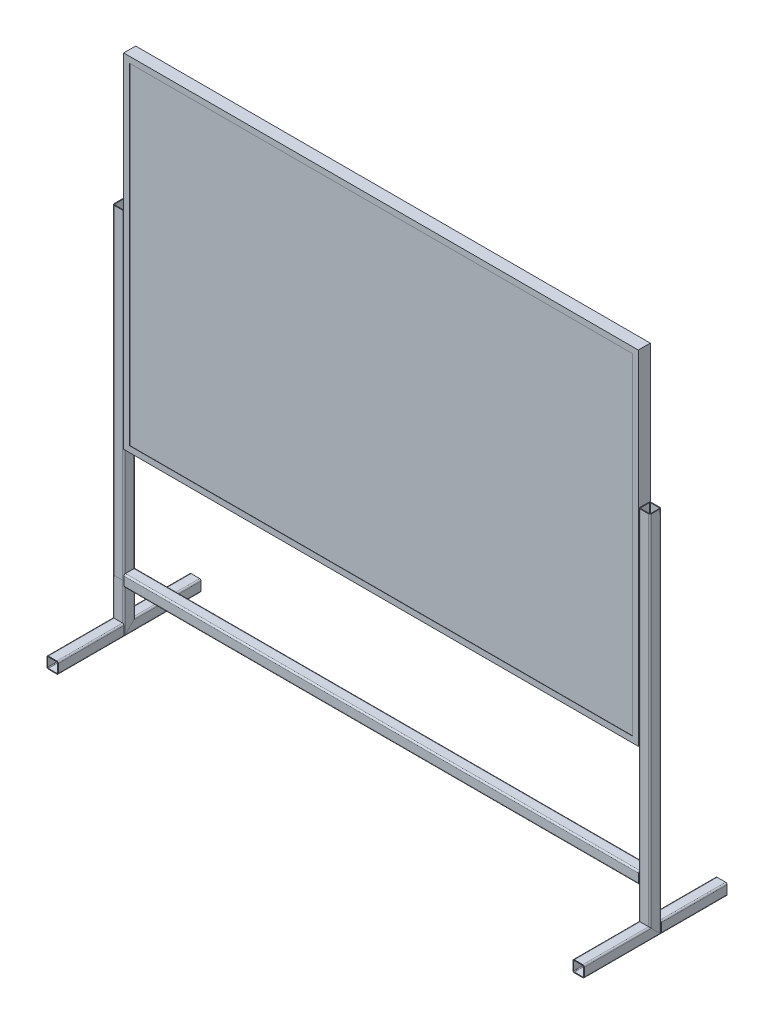
from build123d import *

# Parameters (mm, degrees)
SKETCH1_W                               = 1800
SKETCH1_H                               = 1200
SKETCH1_W_2                             = 1760
SKETCH1_H_2                             = 1160
BOSS_EXTRUDE1_DEPTH                     = 40
SKETCH1_3_W                             = 1800
SKETCH1_3_H                             = 1200
SKETCH1_3_W_2                           = 1760
SKETCH1_3_H_2                           = 1160
BOSS_EXTRUDE2_DEPTH                     = 1
BOSS_EXTRUDE3_START                     = 40
SKETCH1_5_W                             = 1800
SKETCH1_5_H                             = 1200
SKETCH1_5_W_2                           = 1760
SKETCH1_5_H_2                           = 1160
BOSS_EXTRUDE3_DEPTH                     = 1
SKETCH2_W                               = 42
SKETCH2_H                               = 1200
BOSS_EXTRUDE4_DEPTH                     = 1
BOSS_EXTRUDE5_START                     = -1800
SKETCH2_2_W                             = 42
SKETCH2_2_H                             = 1200
BOSS_EXTRUDE5_DEPTH                     = 1
SKETCH3_W                               = 1802
SKETCH3_H                               = 42
BOSS_EXTRUDE6_DEPTH                     = 1
BOSS_EXTRUDE7_START                     = -1200
SKETCH3_2_W                             = 1802
SKETCH3_2_H                             = 42
BOSS_EXTRUDE7_DEPTH                     = 1
TUBE_START                              = -230
TUBE_SQUARE_40_X_40_X_2_6_1_DEPTH       = 230
TUBE_START_2                            = 40
TUBE_SQUARE_40_X_40_X_2_6_1_2_DEPTH     = 230
TUBE_START_3                            = 901.060567096
TUBE_SQUARE_40_X_40_X_2_6_1_3_DEPTH     = 39.871863602
TUBE_START_4                            = 901
TUBE_SQUARE_40_X_40_X_2_6_1_4_DEPTH     = 40
TUBE_START_5                            = -1
TUBE_SQUARE_40_X_40_X_2_6_1_5_DEPTH     = 41
TUBE_START_6                            = -1171
TUBE_SQUARE_40_X_40_X_2_6_1_6_DEPTH     = 1292
TUBE_START_7                            = -857
TUBE_SQUARE_40_X_40_X_2_6_1_7_OUTLINE_W = 42
TUBE_SQUARE_40_X_40_X_2_6_1_7_OUTLINE_H = 60
TUBE_SQUARE_40_X_40_X_2_6_1_7_DEPTH     = 28.977959231
TUBE_SQUARE_40_X_40_X_2_6_1_8_DEPTH     = 230
TUBE_SQUARE_40_X_40_X_2_6_1_9_DEPTH     = 230
TUBE_START_8                            = -940.939432904
TUBE_SQUARE_40_X_40_X_2_6_1_10_DEPTH    = 39.871863602
TUBE_START_9                            = -941
TUBE_SQUARE_40_X_40_X_2_6_1_11_DEPTH    = 40
TUBE_SQUARE_40_X_40_X_2_6_1_12_DEPTH    = 41
TUBE_START_10                           = -1131
TUBE_SQUARE_40_X_40_X_2_6_1_13_DEPTH    = 130
TUBE_SQUARE_40_X_40_X_2_6_1_14_DEPTH    = 39.871863602
TUBE_SQUARE_40_X_40_X_2_6_1_15_DEPTH    = 40
TUBE_START_11                           = -1172
TUBE_SQUARE_40_X_40_X_2_6_1_16_DEPTH    = 41
TUBE_START_12                           = -901
TUBE_SQUARE_40_X_40_X_2_6_1_17_DEPTH    = 1802
TUBE_START_13                           = -1001
TUBE_SQUARE_40_X_40_X_2_6_1_18_DEPTH    = 1122


with BuildPart() as part:
    # Sketch1 → Boss-Extrude1 (new body)
    # profile 1 of 2: a face of its own
    with BuildSketch(Plane.XY):
        Rectangle(SKETCH1_W, SKETCH1_H)
        Rectangle(SKETCH1_W_2, SKETCH1_H_2, mode=Mode.SUBTRACT)
    # profile 2 of 2: a face of its own
    with BuildSketch(Plane.XY):
        Rectangle(SKETCH1_W_2, SKETCH1_H_2)
    extrude(amount=BOSS_EXTRUDE1_DEPTH)


with BuildPart() as body_2:
    # Sketch1<3> → Boss-Extrude2 (new body)
    with BuildSketch(Plane.XY):
        Rectangle(SKETCH1_3_W, SKETCH1_3_H)
        Rectangle(SKETCH1_3_W_2, SKETCH1_3_H_2, mode=Mode.SUBTRACT)
    extrude(amount=-BOSS_EXTRUDE2_DEPTH)



with BuildPart() as body_3:
    # Sketch1<5> → Boss-Extrude3 (new body)
    with BuildSketch(Plane.XY.offset(BOSS_EXTRUDE3_START)):
        Rectangle(SKETCH1_5_W, SKETCH1_5_H)
        Rectangle(SKETCH1_5_W_2, SKETCH1_5_H_2, mode=Mode.SUBTRACT)
    extrude(amount=BOSS_EXTRUDE3_DEPTH)


with BuildPart() as body_2_1:
    add(body_2.part)

    add(body_3.part)  # Boss-Extrude4 merges body 3
    # Sketch2 → Boss-Extrude4 (add)
    with BuildSketch(Plane.ZY.offset(900)):
        with Locations((20, 0)):
            Rectangle(SKETCH2_W, SKETCH2_H)
    extrude(amount=BOSS_EXTRUDE4_DEPTH)

    # Sketch2<2> → Boss-Extrude5 (add)
    with BuildSketch(Plane.ZY.offset(900).offset(BOSS_EXTRUDE5_START)):
        with Locations((20, 0)):
            Rectangle(SKETCH2_2_W, SKETCH2_2_H)
    extrude(amount=-BOSS_EXTRUDE5_DEPTH)

    # Sketch3 → Boss-Extrude6 (add)
    with BuildSketch(Plane(origin=(0, 600, 0), x_dir=(1, 0, 0), z_dir=(0, 1, 0))):
        with Locations((0, -20)):
            Rectangle(SKETCH3_W, SKETCH3_H)
    extrude(amount=BOSS_EXTRUDE6_DEPTH)

    # Sketch3<2> → Boss-Extrude7 (add)
    with BuildSketch(Plane(origin=(0, 600, 0), x_dir=(1, 0, 0), z_dir=(0, 1, 0)).offset(BOSS_EXTRUDE7_START)):
        with Locations((0, -20)):
            Rectangle(SKETCH3_2_W, SKETCH3_2_H)
    extrude(amount=-BOSS_EXTRUDE7_DEPTH)


with BuildPart() as body_3_2:
    # Tube (square) 40 X 40 X 2.6(1): read off the stored shape, not the designer's step
    # Tube (square) 40 X 40 X 2.6(1) outline → Tube (square) 40 X 40 X 2.6(1) (new body)
    with BuildSketch(Plane.XY.offset(TUBE_START)):
        with BuildLine():
            Line((906.2, -1171), (935.8, -1171))
            ThreePointArc((935.8, -1171), (939.476955262, -1169.476955262), (941, -1165.8))
            Line((941, -1165.8), (941, -1136.2))
            ThreePointArc((941, -1136.2), (939.476955262, -1132.523044738), (935.8, -1131))
            Line((935.8, -1131), (906.2, -1131))
            ThreePointArc((906.2, -1131), (902.523044738, -1132.523044738), (901, -1136.2))
            Line((901, -1136.2), (901, -1165.8))
            ThreePointArc((901, -1165.8), (902.523044738, -1169.476955262), (906.2, -1171))
        make_face()
        with BuildLine():
            ThreePointArc((906.2, -1168.4), (904.361522369, -1167.638477631), (903.6, -1165.8))
            Line((903.6, -1165.8), (903.6, -1136.2))
            ThreePointArc((903.6, -1136.2), (904.361522369, -1134.361522369), (906.2, -1133.6))
            Line((906.2, -1133.6), (935.8, -1133.6))
            ThreePointArc((935.8, -1133.6), (937.638477631, -1134.361522369), (938.4, -1136.2))
            Line((938.4, -1136.2), (938.4, -1165.8))
            ThreePointArc((938.4, -1165.8), (937.638477631, -1167.638477631), (935.8, -1168.4))
            Line((935.8, -1168.4), (906.2, -1168.4))
        make_face(mode=Mode.SUBTRACT)
    extrude(amount=TUBE_SQUARE_40_X_40_X_2_6_1_DEPTH)


with BuildPart() as body_4:
    # Tube _square_ 40 X 40 X 2.6_1 2 outline → Tube _square_ 40 X 40 X 2.6_1 2 (new body)
    with BuildSketch(Plane.XY.offset(TUBE_START_2)):
        with BuildLine():
            ThreePointArc((941, -1136.2), (939.476955262, -1132.523044738), (935.8, -1131))
            Line((935.8, -1131), (906.2, -1131))
            ThreePointArc((906.2, -1131), (902.523044738, -1132.523044738), (901, -1136.2))
            Line((901, -1136.2), (901, -1165.8))
            ThreePointArc((901, -1165.8), (902.523044738, -1169.476955262), (906.2, -1171))
            Line((906.2, -1171), (935.8, -1171))
            ThreePointArc((935.8, -1171), (939.476955262, -1169.476955262), (941, -1165.8))
            Line((941, -1165.8), (941, -1136.2))
        make_face()
        with BuildLine():
            Line((903.6, -1165.8), (903.6, -1136.2))
            ThreePointArc((903.6, -1136.2), (904.361522369, -1134.361522369), (906.2, -1133.6))
            Line((906.2, -1133.6), (935.8, -1133.6))
            ThreePointArc((935.8, -1133.6), (937.638477631, -1134.361522369), (938.4, -1136.2))
            Line((938.4, -1136.2), (938.4, -1165.8))
            ThreePointArc((938.4, -1165.8), (937.638477631, -1167.638477631), (935.8, -1168.4))
            Line((935.8, -1168.4), (906.2, -1168.4))
            ThreePointArc((906.2, -1168.4), (904.361522369, -1167.638477631), (903.6, -1165.8))
        make_face(mode=Mode.SUBTRACT)
    extrude(amount=TUBE_SQUARE_40_X_40_X_2_6_1_2_DEPTH)

    # Tube _square_ 40 X 40 X 2.6_1 3 outline → Tube _square_ 40 X 40 X 2.6_1 3 (add)
    with BuildSketch(Plane.YZ.offset(TUBE_START_3)):
        Polygon((-1171, 40), (-1171, 0), (-1131, 40), align=None)
    extrude(amount=TUBE_SQUARE_40_X_40_X_2_6_1_3_DEPTH)

    # Tube _square_ 40 X 40 X 2.6_1 4 outline → Tube _square_ 40 X 40 X 2.6_1 4 (add)
    with BuildSketch(Plane.YZ.offset(TUBE_START_4)):
        Polygon((-1168.4, 40), (-1168.4, 2.6), (-1131, 40), align=None)
    extrude(amount=TUBE_SQUARE_40_X_40_X_2_6_1_4_DEPTH)

    # Tube _square_ 40 X 40 X 2.6_1 5 outline → Tube _square_ 40 X 40 X 2.6_1 5 (cut)
    with BuildSketch(Plane.XY.offset(TUBE_START_5)):
        with BuildLine():
            Line((941, -1131), (935.8, -1131))
            ThreePointArc((935.8, -1131), (939.476955262, -1132.523044738), (941, -1136.2))
            Line((941, -1136.2), (941, -1131))
        make_face()
        with BuildLine():
            ThreePointArc((941, -1165.8), (939.476955262, -1169.476955262), (935.8, -1171))
            Line((935.8, -1171), (940.932430698, -1171))
            Line((940.932430698, -1171), (940.932430698, -1168.4))
            Line((940.932430698, -1168.4), (941, -1168.4))
            Line((941, -1168.4), (941, -1165.8))
        make_face()
        with BuildLine():
            ThreePointArc((906.2, -1171), (902.523044738, -1169.476955262), (901, -1165.8))
            Line((901, -1165.8), (901, -1168.4))
            Line((901, -1168.4), (901.060567096, -1168.4))
            Line((901.060567096, -1168.4), (901.060567096, -1171))
            Line((901.060567096, -1171), (906.2, -1171))
        make_face()
        with BuildLine():
            Line((901, -1131), (901, -1136.2))
            ThreePointArc((901, -1136.2), (902.523044738, -1132.523044738), (906.2, -1131))
            Line((906.2, -1131), (901, -1131))
        make_face()
        with BuildLine():
            Line((903.6, -1136.2), (903.6, -1165.8))
            ThreePointArc((903.6, -1165.8), (904.361522369, -1167.638477631), (906.2, -1168.4))
            Line((906.2, -1168.4), (935.8, -1168.4))
            ThreePointArc((935.8, -1168.4), (937.638477631, -1167.638477631), (938.4, -1165.8))
            Line((938.4, -1165.8), (938.4, -1136.2))
            ThreePointArc((938.4, -1136.2), (937.638477631, -1134.361522369), (935.8, -1133.6))
            Line((935.8, -1133.6), (906.2, -1133.6))
            ThreePointArc((906.2, -1133.6), (904.361522369, -1134.361522369), (903.6, -1136.2))
        make_face()
    extrude(amount=TUBE_SQUARE_40_X_40_X_2_6_1_5_DEPTH, mode=Mode.SUBTRACT)


with BuildPart() as body_5:
    # Tube _square_ 40 X 40 X 2.6_1 6 outline → Tube _square_ 40 X 40 X 2.6_1 6 (new body)
    with BuildSketch(Plane(origin=(0, 0, 0), x_dir=(1, 0, 0), z_dir=(0, 1, 0)).offset(TUBE_START_6)):
        with BuildLine():
            Line((906.2, -40), (935.8, -40))
            ThreePointArc((935.8, -40), (939.476955262, -38.476955262), (941, -34.8))
            Line((941, -34.8), (941, -5.2))
            ThreePointArc((941, -5.2), (939.476955262, -1.523044738), (935.8, 0))
            Line((935.8, 0), (906.2, 0))
            ThreePointArc((906.2, 0), (902.523044738, -1.523044738), (901, -5.2))
            Line((901, -5.2), (901, -34.8))
            ThreePointArc((901, -34.8), (902.523044738, -38.476955262), (906.2, -40))
        make_face()
        with BuildLine():
            ThreePointArc((906.2, -37.4), (904.361522369, -36.638477631), (903.6, -34.8))
            Line((903.6, -34.8), (903.6, -5.2))
            ThreePointArc((903.6, -5.2), (904.361522369, -3.361522369), (906.2, -2.6))
            Line((906.2, -2.6), (935.8, -2.6))
            ThreePointArc((935.8, -2.6), (937.638477631, -3.361522369), (938.4, -5.2))
            Line((938.4, -5.2), (938.4, -34.8))
            ThreePointArc((938.4, -34.8), (937.638477631, -36.638477631), (935.8, -37.4))
            Line((935.8, -37.4), (906.2, -37.4))
        make_face(mode=Mode.SUBTRACT)
    extrude(amount=TUBE_SQUARE_40_X_40_X_2_6_1_6_DEPTH)

    # Tube _square_ 40 X 40 X 2.6_1 7 outline → Tube _square_ 40 X 40 X 2.6_1 7 (cut)
    with BuildSketch(Plane(origin=(0, 0, 0), x_dir=(1, 0, 0), z_dir=(0, 0.707106781186548, -0.707106781186547)).offset(TUBE_START_7)):
        with Locations((921, 800)):
            Rectangle(TUBE_SQUARE_40_X_40_X_2_6_1_7_OUTLINE_W, TUBE_SQUARE_40_X_40_X_2_6_1_7_OUTLINE_H)
    extrude(amount=TUBE_SQUARE_40_X_40_X_2_6_1_7_DEPTH, mode=Mode.SUBTRACT)


with BuildPart() as body_6:
    # Tube _square_ 40 X 40 X 2.6_1 8 outline → Tube _square_ 40 X 40 X 2.6_1 8 (new body)
    with BuildSketch(Plane.XY.offset(TUBE_START_2)):
        with BuildLine():
            ThreePointArc((-901, -1136.2), (-902.523044738, -1132.523044738), (-906.2, -1131))
            Line((-906.2, -1131), (-935.8, -1131))
            ThreePointArc((-935.8, -1131), (-939.476955262, -1132.523044738), (-941, -1136.2))
            Line((-941, -1136.2), (-941, -1165.8))
            ThreePointArc((-941, -1165.8), (-939.476955262, -1169.476955262), (-935.8, -1171))
            Line((-935.8, -1171), (-906.2, -1171))
            ThreePointArc((-906.2, -1171), (-902.523044738, -1169.476955262), (-901, -1165.8))
            Line((-901, -1165.8), (-901, -1136.2))
        make_face()
        with BuildLine():
            Line((-938.4, -1165.8), (-938.4, -1136.2))
            ThreePointArc((-938.4, -1136.2), (-937.638477631, -1134.361522369), (-935.8, -1133.6))
            Line((-935.8, -1133.6), (-906.2, -1133.6))
            ThreePointArc((-906.2, -1133.6), (-904.361522369, -1134.361522369), (-903.6, -1136.2))
            Line((-903.6, -1136.2), (-903.6, -1165.8))
            ThreePointArc((-903.6, -1165.8), (-904.361522369, -1167.638477631), (-906.2, -1168.4))
            Line((-906.2, -1168.4), (-935.8, -1168.4))
            ThreePointArc((-935.8, -1168.4), (-937.638477631, -1167.638477631), (-938.4, -1165.8))
        make_face(mode=Mode.SUBTRACT)
    extrude(amount=TUBE_SQUARE_40_X_40_X_2_6_1_8_DEPTH)


with BuildPart() as body_7:
    # Tube _square_ 40 X 40 X 2.6_1 9 outline → Tube _square_ 40 X 40 X 2.6_1 9 (new body)
    with BuildSketch(Plane.XY.offset(TUBE_START)):
        with BuildLine():
            ThreePointArc((-901, -1136.2), (-902.523044738, -1132.523044738), (-906.2, -1131))
            Line((-906.2, -1131), (-935.8, -1131))
            ThreePointArc((-935.8, -1131), (-939.476955262, -1132.523044738), (-941, -1136.2))
            Line((-941, -1136.2), (-941, -1165.8))
            ThreePointArc((-941, -1165.8), (-939.476955262, -1169.476955262), (-935.8, -1171))
            Line((-935.8, -1171), (-906.2, -1171))
            ThreePointArc((-906.2, -1171), (-902.523044738, -1169.476955262), (-901, -1165.8))
            Line((-901, -1165.8), (-901, -1136.2))
        make_face()
        with BuildLine():
            Line((-938.4, -1165.8), (-938.4, -1136.2))
            ThreePointArc((-938.4, -1136.2), (-937.638477631, -1134.361522369), (-935.8, -1133.6))
            Line((-935.8, -1133.6), (-906.2, -1133.6))
            ThreePointArc((-906.2, -1133.6), (-904.361522369, -1134.361522369), (-903.6, -1136.2))
            Line((-903.6, -1136.2), (-903.6, -1165.8))
            ThreePointArc((-903.6, -1165.8), (-904.361522369, -1167.638477631), (-906.2, -1168.4))
            Line((-906.2, -1168.4), (-935.8, -1168.4))
            ThreePointArc((-935.8, -1168.4), (-937.638477631, -1167.638477631), (-938.4, -1165.8))
        make_face(mode=Mode.SUBTRACT)
    extrude(amount=TUBE_SQUARE_40_X_40_X_2_6_1_9_DEPTH)

    # Tube _square_ 40 X 40 X 2.6_1 10 outline → Tube _square_ 40 X 40 X 2.6_1 10 (add)
    with BuildSketch(Plane.YZ.offset(TUBE_START_8)):
        Polygon((-1171, 40), (-1171, 0), (-1131, 0), align=None)
    extrude(amount=TUBE_SQUARE_40_X_40_X_2_6_1_10_DEPTH)

    # Tube _square_ 40 X 40 X 2.6_1 11 outline → Tube _square_ 40 X 40 X 2.6_1 11 (add)
    with BuildSketch(Plane.YZ.offset(TUBE_START_9)):
        Polygon((-1168.4, 37.4), (-1168.4, 0), (-1131, 0), align=None)
    extrude(amount=TUBE_SQUARE_40_X_40_X_2_6_1_11_DEPTH)

    # Tube _square_ 40 X 40 X 2.6_1 12 outline → Tube _square_ 40 X 40 X 2.6_1 12 (cut)
    with BuildSketch(Plane.XY):
        with BuildLine():
            Line((-938.4, -1136.2), (-938.4, -1165.8))
            ThreePointArc((-938.4, -1165.8), (-937.638477631, -1167.638477631), (-935.8, -1168.4))
            Line((-935.8, -1168.4), (-906.2, -1168.4))
            ThreePointArc((-906.2, -1168.4), (-904.361522369, -1167.638477631), (-903.6, -1165.8))
            Line((-903.6, -1165.8), (-903.6, -1136.2))
            ThreePointArc((-903.6, -1136.2), (-904.361522369, -1134.361522369), (-906.2, -1133.6))
            Line((-906.2, -1133.6), (-935.8, -1133.6))
            ThreePointArc((-935.8, -1133.6), (-937.638477631, -1134.361522369), (-938.4, -1136.2))
        make_face()
        with BuildLine():
            Line((-906.2, -1171), (-901.067569302, -1171))
            Line((-901.067569302, -1171), (-901.067569302, -1168.4))
            Line((-901.067569302, -1168.4), (-901, -1168.4))
            Line((-901, -1168.4), (-901, -1165.8))
            ThreePointArc((-901, -1165.8), (-902.523044738, -1169.476955262), (-906.2, -1171))
        make_face()
        with BuildLine():
            Line((-935.8, -1131), (-941, -1131))
            Line((-941, -1131), (-941, -1136.2))
            ThreePointArc((-941, -1136.2), (-939.476955262, -1132.523044738), (-935.8, -1131))
        make_face()
        with BuildLine():
            Line((-941, -1168.4), (-940.939432904, -1168.4))
            Line((-940.939432904, -1168.4), (-940.939432904, -1171))
            Line((-940.939432904, -1171), (-935.8, -1171))
            ThreePointArc((-935.8, -1171), (-939.476955262, -1169.476955262), (-941, -1165.8))
            Line((-941, -1165.8), (-941, -1168.4))
        make_face()
        with BuildLine():
            Line((-901, -1131), (-906.2, -1131))
            ThreePointArc((-906.2, -1131), (-902.523044738, -1132.523044738), (-901, -1136.2))
            Line((-901, -1136.2), (-901, -1131))
        make_face()
    extrude(amount=TUBE_SQUARE_40_X_40_X_2_6_1_12_DEPTH, mode=Mode.SUBTRACT)


with BuildPart() as body_8:
    # Tube _square_ 40 X 40 X 2.6_1 13 outline → Tube _square_ 40 X 40 X 2.6_1 13 (new body)
    with BuildSketch(Plane(origin=(0, 0, 0), x_dir=(1, 0, 0), z_dir=(0, 1, 0)).offset(TUBE_START_10)):
        with BuildLine():
            ThreePointArc((-901, -5.2), (-902.523044738, -1.523044738), (-906.2, 0))
            Line((-906.2, 0), (-935.8, 0))
            ThreePointArc((-935.8, 0), (-939.476955262, -1.523044738), (-941, -5.2))
            Line((-941, -5.2), (-941, -34.8))
            ThreePointArc((-941, -34.8), (-939.476955262, -38.476955262), (-935.8, -40))
            Line((-935.8, -40), (-906.2, -40))
            ThreePointArc((-906.2, -40), (-902.523044738, -38.476955262), (-901, -34.8))
            Line((-901, -34.8), (-901, -5.2))
        make_face()
        with BuildLine():
            Line((-938.4, -34.8), (-938.4, -5.2))
            ThreePointArc((-938.4, -5.2), (-937.638477631, -3.361522369), (-935.8, -2.6))
            Line((-935.8, -2.6), (-906.2, -2.6))
            ThreePointArc((-906.2, -2.6), (-904.361522369, -3.361522369), (-903.6, -5.2))
            Line((-903.6, -5.2), (-903.6, -34.8))
            ThreePointArc((-903.6, -34.8), (-904.361522369, -36.638477631), (-906.2, -37.4))
            Line((-906.2, -37.4), (-935.8, -37.4))
            ThreePointArc((-935.8, -37.4), (-937.638477631, -36.638477631), (-938.4, -34.8))
        make_face(mode=Mode.SUBTRACT)
    extrude(amount=TUBE_SQUARE_40_X_40_X_2_6_1_13_DEPTH)

    # Tube _square_ 40 X 40 X 2.6_1 14 outline → Tube _square_ 40 X 40 X 2.6_1 14 (add)
    with BuildSketch(Plane.YZ.offset(TUBE_START_8)):
        Polygon((-1131, 40), (-1171, 40), (-1131, 0), align=None)
    extrude(amount=TUBE_SQUARE_40_X_40_X_2_6_1_14_DEPTH)

    # Tube _square_ 40 X 40 X 2.6_1 15 outline → Tube _square_ 40 X 40 X 2.6_1 15 (add)
    with BuildSketch(Plane.YZ.offset(TUBE_START_9)):
        Polygon((-1131, 37.4), (-1168.4, 37.4), (-1131, 0), align=None)
    extrude(amount=TUBE_SQUARE_40_X_40_X_2_6_1_15_DEPTH)

    # Tube _square_ 40 X 40 X 2.6_1 16 outline → Tube _square_ 40 X 40 X 2.6_1 16 (cut)
    with BuildSketch(Plane(origin=(0, 0, 0), x_dir=(1, 0, 0), z_dir=(0, 1, 0)).offset(TUBE_START_11)):
        with BuildLine():
            ThreePointArc((-901, -34.8), (-902.523044738, -38.476955262), (-906.2, -40))
            Line((-906.2, -40), (-901.067569302, -40))
            Line((-901.067569302, -40), (-901.067569302, -37.4))
            Line((-901.067569302, -37.4), (-901, -37.4))
            Line((-901, -37.4), (-901, -34.8))
        make_face()
        with BuildLine():
            Line((-941, -37.4), (-940.939432904, -37.4))
            Line((-940.939432904, -37.4), (-940.939432904, -40))
            Line((-940.939432904, -40), (-935.8, -40))
            ThreePointArc((-935.8, -40), (-939.476955262, -38.476955262), (-941, -34.8))
            Line((-941, -34.8), (-941, -37.4))
        make_face()
        with BuildLine():
            Line((-941, 0), (-941, -5.2))
            ThreePointArc((-941, -5.2), (-939.476955262, -1.523044738), (-935.8, 0))
            Line((-935.8, 0), (-941, 0))
        make_face()
        with BuildLine():
            Line((-901, 0), (-906.2, 0))
            ThreePointArc((-906.2, 0), (-902.523044738, -1.523044738), (-901, -5.2))
            Line((-901, -5.2), (-901, 0))
        make_face()
        with BuildLine():
            Line((-938.4, -5.2), (-938.4, -34.8))
            ThreePointArc((-938.4, -34.8), (-937.638477631, -36.638477631), (-935.8, -37.4))
            Line((-935.8, -37.4), (-906.2, -37.4))
            ThreePointArc((-906.2, -37.4), (-904.361522369, -36.638477631), (-903.6, -34.8))
            Line((-903.6, -34.8), (-903.6, -5.2))
            ThreePointArc((-903.6, -5.2), (-904.361522369, -3.361522369), (-906.2, -2.6))
            Line((-906.2, -2.6), (-935.8, -2.6))
            ThreePointArc((-935.8, -2.6), (-937.638477631, -3.361522369), (-938.4, -5.2))
        make_face()
    extrude(amount=TUBE_SQUARE_40_X_40_X_2_6_1_16_DEPTH, mode=Mode.SUBTRACT)


with BuildPart() as body_9:
    # Tube _square_ 40 X 40 X 2.6_1 17 outline → Tube _square_ 40 X 40 X 2.6_1 17 (new body)
    with BuildSketch(Plane.YZ.offset(TUBE_START_12)):
        with BuildLine():
            Line((-986.2, 40), (-1015.8, 40))
            ThreePointArc((-1015.8, 40), (-1019.476955262, 38.476955262), (-1021, 34.8))
            Line((-1021, 34.8), (-1021, 5.2))
            ThreePointArc((-1021, 5.2), (-1019.476955262, 1.523044738), (-1015.8, 0))
            Line((-1015.8, 0), (-986.2, 0))
            ThreePointArc((-986.2, 0), (-982.523044738, 1.523044738), (-981, 5.2))
            Line((-981, 5.2), (-981, 34.8))
            ThreePointArc((-981, 34.8), (-982.523044738, 38.476955262), (-986.2, 40))
        make_face()
        with BuildLine():
            ThreePointArc((-983.6, 5.2), (-984.361522369, 3.361522369), (-986.2, 2.6))
            Line((-986.2, 2.6), (-1015.8, 2.6))
            ThreePointArc((-1015.8, 2.6), (-1017.638477631, 3.361522369), (-1018.4, 5.2))
            Line((-1018.4, 5.2), (-1018.4, 34.8))
            ThreePointArc((-1018.4, 34.8), (-1017.638477631, 36.638477631), (-1015.8, 37.4))
            Line((-1015.8, 37.4), (-986.2, 37.4))
            ThreePointArc((-986.2, 37.4), (-984.361522369, 36.638477631), (-983.6, 34.8))
            Line((-983.6, 34.8), (-983.6, 5.2))
        make_face(mode=Mode.SUBTRACT)
    extrude(amount=TUBE_SQUARE_40_X_40_X_2_6_1_17_DEPTH)


with BuildPart() as body_10:
    # Tube _square_ 40 X 40 X 2.6_1 18 outline → Tube _square_ 40 X 40 X 2.6_1 18 (new body)
    with BuildSketch(Plane(origin=(0, 0, 0), x_dir=(1, 0, 0), z_dir=(0, 1, 0)).offset(TUBE_START_13)):
        with BuildLine():
            ThreePointArc((-901, -5.2), (-902.523044738, -1.523044738), (-906.2, 0))
            Line((-906.2, 0), (-935.8, 0))
            ThreePointArc((-935.8, 0), (-939.476955262, -1.523044738), (-941, -5.2))
            Line((-941, -5.2), (-941, -34.8))
            ThreePointArc((-941, -34.8), (-939.476955262, -38.476955262), (-935.8, -40))
            Line((-935.8, -40), (-906.2, -40))
            ThreePointArc((-906.2, -40), (-902.523044738, -38.476955262), (-901, -34.8))
            Line((-901, -34.8), (-901, -5.2))
        make_face()
        with BuildLine():
            Line((-938.4, -34.8), (-938.4, -5.2))
            ThreePointArc((-938.4, -5.2), (-937.638477631, -3.361522369), (-935.8, -2.6))
            Line((-935.8, -2.6), (-906.2, -2.6))
            ThreePointArc((-906.2, -2.6), (-904.361522369, -3.361522369), (-903.6, -5.2))
            Line((-903.6, -5.2), (-903.6, -34.8))
            ThreePointArc((-903.6, -34.8), (-904.361522369, -36.638477631), (-906.2, -37.4))
            Line((-906.2, -37.4), (-935.8, -37.4))
            ThreePointArc((-935.8, -37.4), (-937.638477631, -36.638477631), (-938.4, -34.8))
        make_face(mode=Mode.SUBTRACT)
    extrude(amount=TUBE_SQUARE_40_X_40_X_2_6_1_18_DEPTH)


solid = Compound([part.part, body_2_1.part, body_3_2.part, body_4.part, body_5.part, body_6.part, body_7.part, body_8.part, body_9.part, body_10.part])
